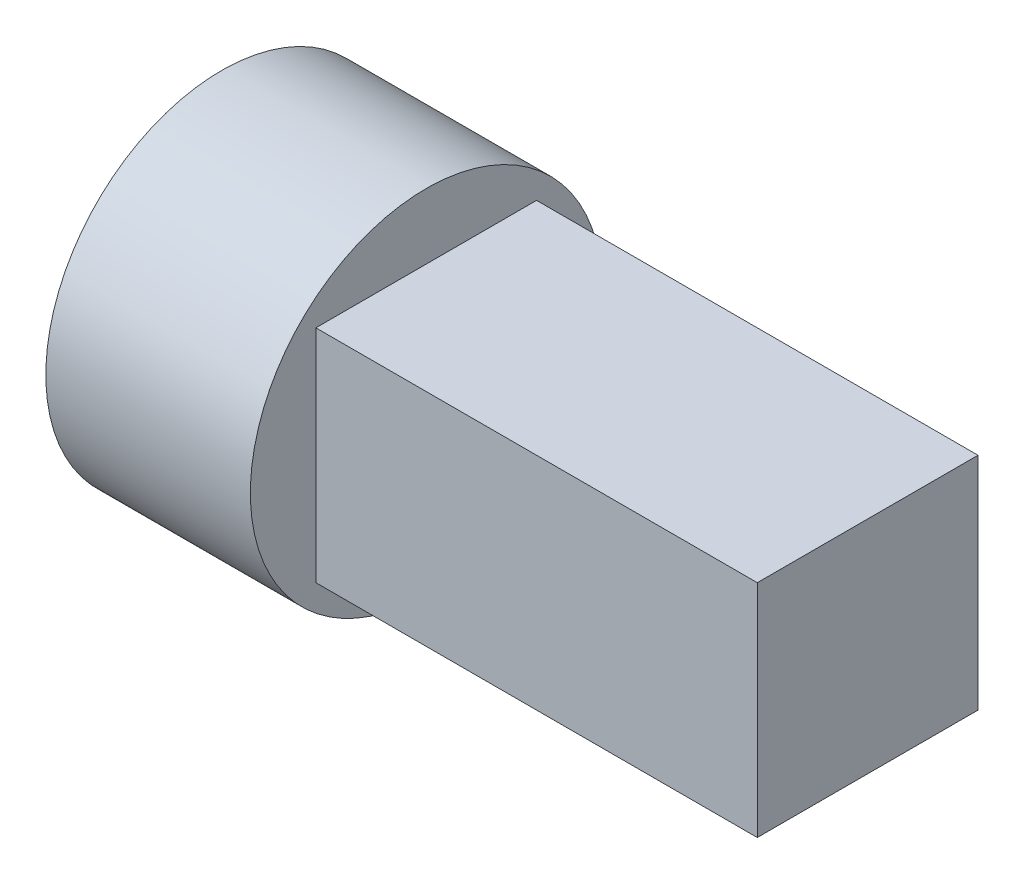
from build123d import *

# Parameters (mm, degrees)
SKETCH1_R           = 4.78
BOSS_EXTRUDE1_DEPTH = 2.78
SKETCH2_W           = 6
SKETCH2_H           = 6
BOSS_EXTRUDE2_DEPTH = 12


with BuildPart() as part:
    # Sketch1 → Boss-Extrude1 (new, symmetric)
    with BuildSketch(Plane(origin=(0, 0, 0), x_dir=(0, 0, -1), z_dir=(1, 0, 0))):
        Circle(SKETCH1_R)
    extrude(amount=BOSS_EXTRUDE1_DEPTH, both=True)

    # Sketch2 → Boss-Extrude2 (add)
    with BuildSketch(Plane(origin=(2.78, 0, 0), x_dir=(0, 0, -1), z_dir=(1, 0, 0))):
        Rectangle(SKETCH2_W, SKETCH2_H)
    extrude(amount=BOSS_EXTRUDE2_DEPTH)


solid = part.part
